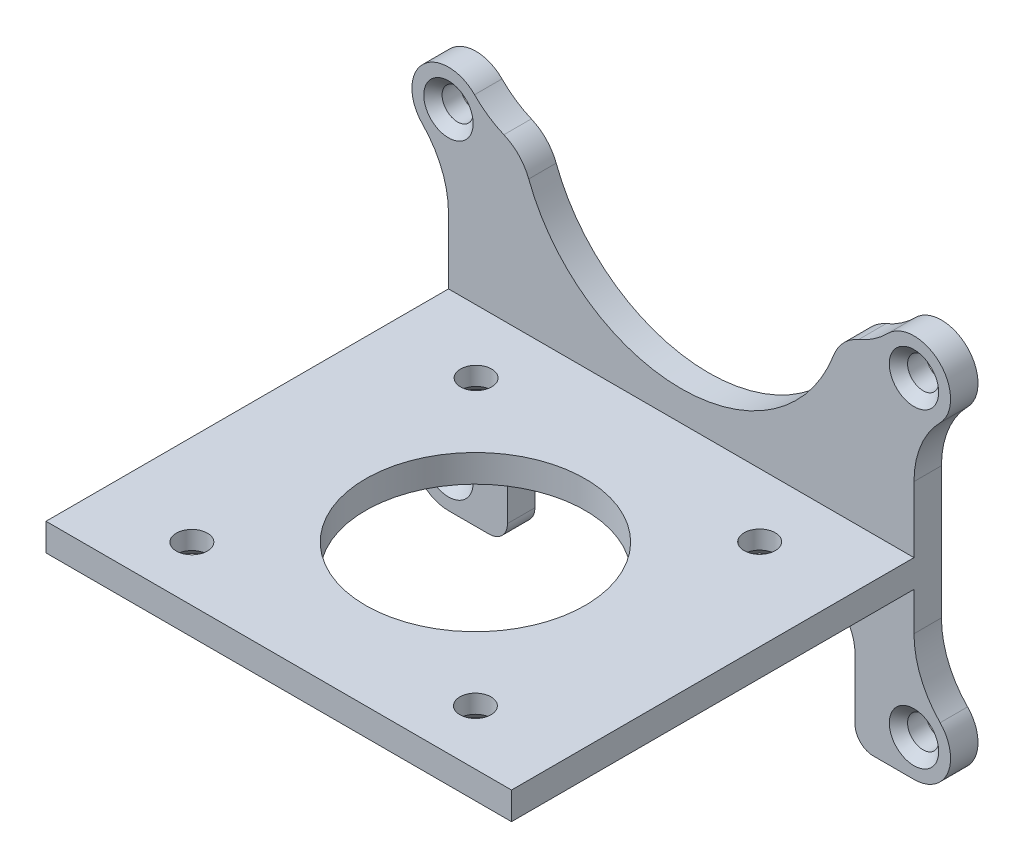
from build123d import *

# Parameters (mm, degrees)
SKETCH_1_R          = 1.7
EXTRUDE_1_DEPTH     = 3
EXTRUDE_2_DEPTH     = 44
SKETCH_3_R          = 1.7
SKETCH_3_R_2        = 12
CUT_EXTRUDE_1_DEPTH = 4
SKETCH_4_W          = 38
SKETCH_4_H          = 9.646779348
SKETCH_4_H_2        = 4
CUT_EXTRUDE_2_DEPTH = 4
FILLET_1_R          = 10
CHAMFER_1_SIZE      = 1
CHAMFER_2_SIZE      = 1
FILLET_4_R          = 5
FILLET_5_R          = 2
FILLET_6_R          = 5


with BuildPart() as part:
    # Эскиз1 → Бобышка-Вытянуть1 (new body)
    with BuildSketch(Plane.XY):
        with BuildLine():
            ThreePointArc((0, 4), (-4, 0), (0, -4))
            Line((0, -4), (50.89, -4))
            ThreePointArc((50.89, -4), (54.89, 0), (50.89, 4))
            Line((50.89, 4), (50.89, 30))
            ThreePointArc((50.89, 30), (53.718427125, 36.828427125), (46.89, 34))
            Line((46.89, 34), (4, 34))
            ThreePointArc((4, 34), (-2.828427125, 36.828427125), (0, 30))
            Line((0, 30), (0, 4))
        make_face()
        with Locations((50.89, 34)):
            Circle(SKETCH_1_R, mode=Mode.SUBTRACT)
        Circle(SKETCH_1_R, mode=Mode.SUBTRACT)
        with Locations((50.89, 0)):
            Circle(SKETCH_1_R, mode=Mode.SUBTRACT)
        with Locations((0, 34)):
            Circle(SKETCH_1_R, mode=Mode.SUBTRACT)
    extrude(amount=EXTRUDE_1_DEPTH)

    # Эскиз2 → Бобышка-Вытянуть2 (add)
    with BuildSketch(Plane.XY.offset(3)):
        Polygon((50.89, 17), (28.893119951, 17), (0, 17), (0, 14), (50.89, 14), align=None)
    extrude(amount=EXTRUDE_2_DEPTH)

    # Эскиз3 → Вырез-Вытянуть1 (cut)
    with BuildSketch(Plane(origin=(0, 17, 0), x_dir=(1, 0, 0), z_dir=(0, 1, 0))):
        with Locations(Location((9.945, -40.999892664, 0), (0, 0, 270))):
            Circle(SKETCH_3_R)
        with Locations(Location((25.445, -25.5, 0), (0, 0, 270))):
            Circle(SKETCH_3_R_2)
        with Locations(Location((9.945, -9.924036406, 0), (0, 0, 270))):
            Circle(SKETCH_3_R)
        with Locations(Location((40.945, -9.924036406, 0), (0, 0, 270))):
            Circle(SKETCH_3_R)
        with Locations(Location((40.945, -40.999892664, 0), (0, 0, 270))):
            Circle(SKETCH_3_R)
    extrude(amount=-CUT_EXTRUDE_1_DEPTH, mode=Mode.SUBTRACT)

    # Эскиз4 → Вырез-Вытянуть2 (cut)
    with BuildSketch(Plane.XY.offset(3)):
        with BuildLine():
            Line((25.445, 34), (10.58125454, 34))
            Line((10.58125454, 34), (8.098408954, 34))
            ThreePointArc((8.098408954, 34), (25.445, 20.270756407), (42.791591046, 34))
            Line((42.791591046, 34), (25.445, 34))
        make_face()
        with Locations((25.445, 4.823389674)):
            Rectangle(SKETCH_4_W, SKETCH_4_H)
        with Locations((25.445, -2)):
            Rectangle(SKETCH_4_W, SKETCH_4_H_2)
    extrude(amount=-CUT_EXTRUDE_2_DEPTH, mode=Mode.SUBTRACT)

    # Скругление1
    # the kernel refuses this fillet: 10 mm, written as the material it adds along each edge
    with BuildSketch(Plane(origin=(0, 30, 0), x_dir=(0, -1, 0), z_dir=(0, 0, 1)), Plane(origin=(50.89, 4, 0), x_dir=(0, 1, 0), z_dir=(0, 0, 1))) as fillet_1_piece_1:
        with BuildLine():
            CenterArc((5.797958971, -10), FILLET_1_R, 90, 44.415308597)
            Line((-1.200583151, -2.857142857), (-1.340553994, -2.714285714))
            ThreePointArc((-1.340553994, -2.714285714), (-0.496723332, -1.472091229), (-0.2, 0))
            Line((-0.2, 0), (0, 0.2))
            Line((0, 0.2), (5.797958971, 0.2))
            Line((5.797958971, 0.2), (5.797958971, 0))
        make_face()
    extrude(amount=3)
    with BuildSketch(Plane(origin=(0, 4, 0), x_dir=(-0.9219149126204018, -0.387392428795552, 0), z_dir=(0, 0, 1)), Plane(origin=(50.89, 30, 0), x_dir=(0.9219149126204016, 0.38739242879555247, 0), z_dir=(0, 0, 1))) as fillet_1_piece_2:
        with BuildLine():
            CenterArc((6.973063718, -9.219149126), FILLET_1_R, 112.792345701, 44.415308597)
            Line((-2.246085408, -5.345224838), (-2.43046839, -5.267746352))
            Line((-2.43046839, -5.267746352), (-0.184382983, 0.077478486))
            Line((-0.184382983, 0.077478486), (0.077478486, 0.184382983))
            ThreePointArc((0.077478486, 0.184382983), (1.549569715, -0.11234035), (3.021660945, 0.184382983))
            Line((3.021660945, 0.184382983), (3.09913943, 0))
        make_face()
    extrude(amount=3)
    with BuildSketch(Plane(origin=(46.89, 34, 0), x_dir=(0.3790827918383792, 0.9253627596418714, 0), z_dir=(0, 0, 1))) as fillet_1_piece_3:
        with BuildLine():
            CenterArc((6.823490253, 9.253627596), FILLET_1_R, 213.100635844, 34.622483912)
            Line((-1.553636308, 3.79251502), (-1.72117884, 3.683292769))
            ThreePointArc((-1.72117884, 3.683292769), (-0.961890706, 1.820440952), (-0.185072552, -0.075816558))
            Line((-0.185072552, -0.075816558), (0.075816558, -0.185072552))
            ThreePointArc((0.075816558, -0.185072552), (1.516331167, 0.098548961), (2.956845776, -0.185072552))
            Line((2.956845776, -0.185072552), (3.032662335, 0))
        make_face()
    extrude(amount=3)
    with BuildSketch(Plane(origin=(4, 34, 0), x_dir=(-0.3790827918383573, 0.9253627596418805, 0), z_dir=(0, 0, 1))) as fillet_1_piece_4:
        with BuildLine():
            CenterArc((6.823490253, -9.253627596), FILLET_1_R, 112.276880243, 34.622483912)
            Line((-1.553636308, -3.79251502), (-1.72117884, -3.683292769))
            ThreePointArc((-1.72117884, -3.683292769), (-0.961890706, -1.820440952), (-0.185072552, 0.075816558))
            Line((-0.185072552, 0.075816558), (0.075816558, 0.185072552))
            ThreePointArc((0.075816558, 0.185072552), (1.516331167, -0.098548961), (2.956845776, 0.185072552))
            Line((2.956845776, 0.185072552), (3.032662335, 0))
        make_face()
    extrude(amount=3)

    # Фаска1
    chamfer_1_edges = [part.edges().sort_by_distance(p)[0] for p in [
        (40.945, 14, 8.224036406),
        (40.945, 14, 39.299892664),
        (9.945, 14, 39.299892664),
        (9.945, 14, 8.224036406),
    ]]
    chamfer(chamfer_1_edges, length=CHAMFER_1_SIZE)

    # Фаска2
    chamfer_2_edges = [part.edges().sort_by_distance(p)[0] for p in [
        (49.19, 34, 3),
        (-1.7, 0, 3),
        (49.19, 0, 3),
        (-1.7, 34, 3),
    ]]
    chamfer(chamfer_2_edges, length=CHAMFER_2_SIZE)

    # Скругление4
    fillet_4_edges = [part.edges().sort_by_distance(p)[0] for p in [
        (6.445, 9.646779348, 1.5),
        (44.445, 9.646779348, 1.5),
    ]]
    fillet(fillet_4_edges, radius=FILLET_4_R)

    # Скругление5
    fillet_5_edges = [part.edges().sort_by_distance(p)[0] for p in [
        (6.445, -4, 1.5),
        (44.445, -4, 1.5),
    ]]
    fillet(fillet_5_edges, radius=FILLET_5_R)

    # Скругление6
    fillet_6_edges = [part.edges().sort_by_distance(p)[0] for p in [
        (8.098408954, 34, 1.5),
        (42.791591046, 34, 1.5),
    ]]
    fillet(fillet_6_edges, radius=FILLET_6_R)


solid = part.part
